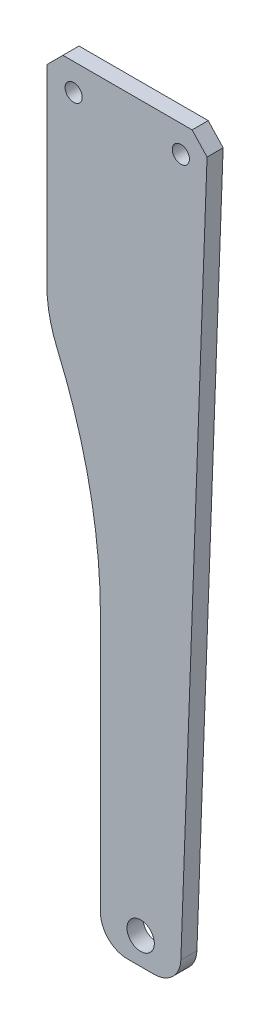
from build123d import *
from OCP.BRepFilletAPI import BRepFilletAPI_MakeChamfer

# Parameters (mm, degrees)
SKETCH_1_W          = 30
SKETCH_1_H          = 140
SKETCH_1_R          = 1.6
EXTRUDE_1_DEPTH     = 3
CUT_EXTRUDE_3_REACH = 139.328
SKETCH_4_W          = 5
SKETCH_4_H          = 55
CHAMFER_1_SIZE      = 2.5
CUT_EXTRUDE_4_REACH = 139.328
SKETCH_5_R          = 2.55
EXTRUDE_5_DEPTH     = 3
EXTRUDE_2_DEPTH     = 3
FILLET_2_R          = 65
FILLET_3_R          = 115
FILLET_4_R          = 5
CUT_EXTRUDE_START   = -3
CUT_EXTRUDE_6_DEPTH = 3
CHAMFER_2_SIZE      = 3
CHAMFER_2_SIZE2     = 2.894908666


# Read off the part's stored shape, not the designer's step: 切除-拉伸6
with BuildPart() as part:
    # 草图1 → 凸台-拉伸1 (new body)
    with BuildSketch(Plane.XY):
        with Locations((10, -65)):
            Rectangle(SKETCH_1_W, SKETCH_1_H)
        Circle(SKETCH_1_R, mode=Mode.SUBTRACT)
        with Locations((20, 0)):
            Circle(SKETCH_1_R, mode=Mode.SUBTRACT)
    extrude(amount=EXTRUDE_1_DEPTH)

    # 草图4 → 切除-拉伸3 (cut, up to next)
    with BuildSketch(Plane.XY.offset(3), mode=Mode.PRIVATE) as cut_extrude_3_sk1:
        with Locations((-2.5, -107.5)):
            Rectangle(SKETCH_4_W, SKETCH_4_H)
    cut_extrude_3_tool1 = extrude(cut_extrude_3_sk1.sketch, amount=-CUT_EXTRUDE_3_REACH, mode=Mode.PRIVATE) & part.part
    add(cut_extrude_3_tool1.solids().sort_by_distance((-2.5, -107.5, 3))[0], mode=Mode.SUBTRACT)

    # 倒角1
    chamfer_1_edges = [part.edges().sort_by_distance(p)[0] for p in [
        (-5, -80, 1.5),
    ]]
    chamfer(chamfer_1_edges, length=CHAMFER_1_SIZE)

    # 草图5 → 切除-拉伸4 (cut, up to next)
    with BuildSketch(Plane.XY.offset(3), mode=Mode.PRIVATE) as cut_extrude_4_sk1:
        with Locations((12.5, -130)):
            Circle(SKETCH_5_R)
    cut_extrude_4_tool1 = extrude(cut_extrude_4_sk1.sketch, amount=-CUT_EXTRUDE_4_REACH, mode=Mode.PRIVATE) & part.part
    add(cut_extrude_4_tool1.solids().sort_by_distance((12.5, -130, 3))[0], mode=Mode.SUBTRACT)

    # 草图9 → 凸台-拉伸5 (add)
    with BuildSketch(Plane(origin=(0, 0, 0), x_dir=(-1, 0, 0), z_dir=(0, 0, -1))):
        Polygon((5, -77.5), (0, -107.5), (0, -80), (2.5, -80), align=None)
    extrude(amount=-EXTRUDE_5_DEPTH)

    # 草图11 → 拉伸-薄壁2 (add)
    with BuildSketch(Plane.XY.offset(3)):
        Polygon((19.5, -67.916286439), (19.5, -61.710608008), (19.5, -3.420169007), (16.5, -3.420169007), (16.5, -61.710608008), (16.5, -67.916286439), align=None)
    extrude(amount=-EXTRUDE_2_DEPTH)

    # 圆角2
    fillet_2_edges = [part.edges().sort_by_distance(p)[0] for p in [
        (-5, -77.5, 1.5),
    ]]
    fillet(fillet_2_edges, radius=FILLET_2_R)

    # 圆角3
    fillet_3_edges = [part.edges().sort_by_distance(p)[0] for p in [
        (0, -107.5, 1.5),
    ]]
    fillet(fillet_3_edges, radius=FILLET_3_R)

    # 圆角4
    fillet_4_edges = [part.edges().sort_by_distance(p)[0] for p in [
        (0, -135, 1.5),
    ]]
    fillet(fillet_4_edges, radius=FILLET_4_R)

    # 切除-拉伸6 outline → 切除-拉伸6 (cut)
    with BuildSketch(Plane.XY.offset(3).offset(CUT_EXTRUDE_START)):
        with BuildLine():
            ThreePointArc((19.996578854, -130.184931767), (18.469534635, -133.600323516), (15, -135))
            Line((15, -135), (25, -135))
            Line((25, -135), (25, 5))
            Line((25, 5), (19.996578854, -130.184931767))
        make_face()
        with BuildLine():
            ThreePointArc((10, -135), (6.464466094, -133.535533906), (5, -130))
            Line((5, -130), (5, -82.212778368))
            ThreePointArc((5, -82.212778368), (2.962270532, -62.17737686), (-3.067466378, -42.962488681))
            ThreePointArc((-3.067466378, -42.962488681), (-4.511868965, -38.359628786), (-5, -33.560217765))
            Line((-5, -33.560217765), (-5, -72.120435531))
            ThreePointArc((-5, -72.120435531), (-4.778523942, -77.481670081), (-4.115605049, -82.806369705))
            Line((-4.115605049, -82.806369705), (-1.564698759, -98.111807444))
            ThreePointArc((-1.564698759, -98.111807444), (-0.391842257, -107.532429856), (0, -117.017690984))
            Line((0, -117.017690984), (0, -130))
            ThreePointArc((0, -130), (1.464466094, -133.535533906), (5, -135))
            Line((5, -135), (10, -135))
        make_face()
    extrude(amount=CUT_EXTRUDE_6_DEPTH, mode=Mode.SUBTRACT)

    # 倒角2: one chamfer whose edges measure the first distance from different faces: ONE call of the kernel's chamfer builder (chamfer() names one face for all edges)
    chamfer_2_edges_1 = [part.edges().sort_by_distance(p)[0] for p in [
        (-5, 5, 1.5),
    ]]
    chamfer_2_edges_2 = [part.edges().sort_by_distance(p)[0] for p in [
        (25, 5, 1.5),
    ]]
    chamfer_2_side_2 = [part.faces().sort_by_distance(p)[0] for p in [
        (22.498289427, -62.592465884, 1.5),
    ]]
    chamfer_2 = BRepFilletAPI_MakeChamfer(part.part.solid().wrapped)
    for e in chamfer_2_edges_1:
        chamfer_2.Add(CHAMFER_2_SIZE, e.wrapped)
    for e in chamfer_2_edges_2:
        chamfer_2.Add(CHAMFER_2_SIZE, CHAMFER_2_SIZE2, e.wrapped, chamfer_2_side_2[0].wrapped)  # the first distance lies on this face
    add(Compound.cast(chamfer_2.Shape()), mode=Mode.REPLACE)


solid = part.part
